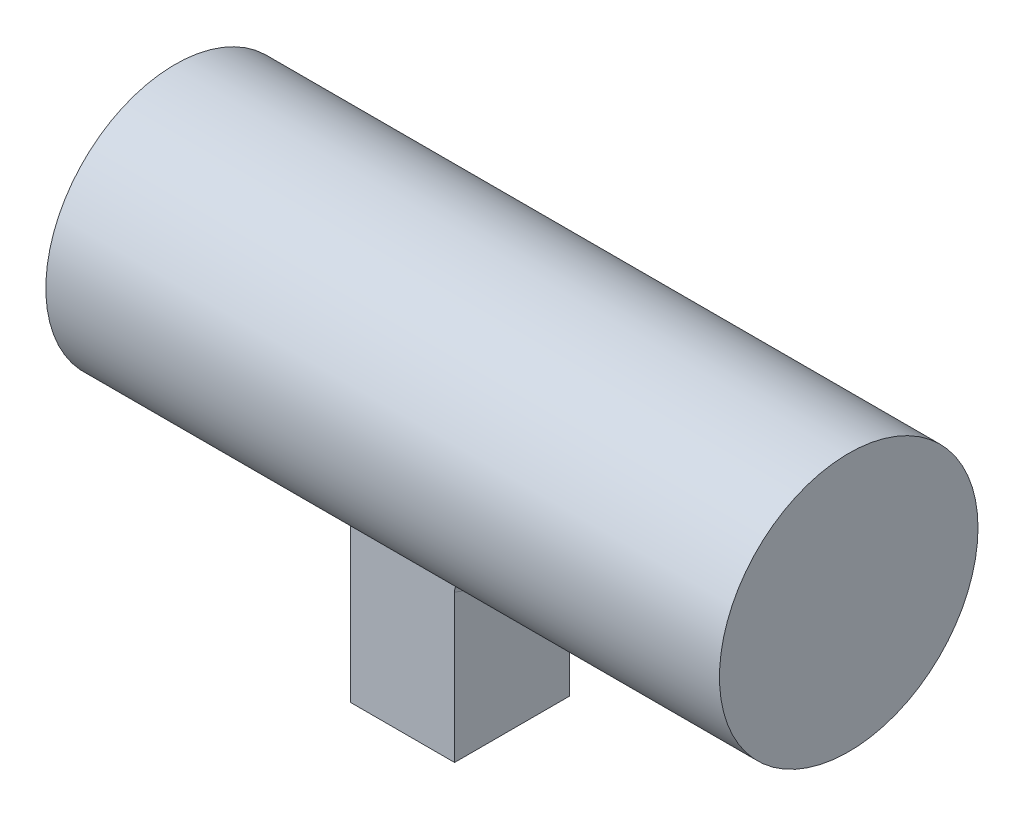
from build123d import *

# Parameters (mm, degrees)
SKETCH_1_W           = 15.445067976
SKETCH_1_H           = 17.0246772
EXTRUDE_1_DEPTH      = 50
EXTRUDE_2_DEPTH      = 50
EXTRUDE_2_DEPTH_BACK = 50
SKETCH_2_R           = 19.191040977
FILLET_3_R           = 2


with BuildPart() as part:
    # 草图1 → 凸台-拉伸1 (new body)
    with BuildSketch(Plane(origin=(0, 0, 0), x_dir=(1, 0, 0), z_dir=(0, 1, 0))):
        Rectangle(SKETCH_1_W, SKETCH_1_H)
    extrude(amount=EXTRUDE_1_DEPTH)

    # 草图2 → 凸台-拉伸2 (add, two sides: drawn at the far end of the back side and taken through both)
    with BuildSketch(Plane(origin=(7.722533988, 0, 0), x_dir=(0, 0, -1), z_dir=(1, 0, 0)).offset(-EXTRUDE_2_DEPTH_BACK)):
        with Locations((0, 41.312136517)):
            Circle(SKETCH_2_R)
    extrude(amount=EXTRUDE_2_DEPTH + EXTRUDE_2_DEPTH_BACK)

    # 圆角3
    # the kernel refuses this fillet: 2 mm, written as the material it adds along each edge
    with BuildSketch(Plane(origin=(7.722533988, 41.312136517, 0), x_dir=(0, -0.7517142761643256, 0.6594889286491047), z_dir=(0, 0.6594889286491047, 0.7517142761643256))) as fillet_3_piece_1_section:
        with BuildLine():
            CenterArc((19.191040977 + FILLET_3_R, FILLET_3_R), FILLET_3_R, 180, 90)
            Line((19.191040977, FILLET_3_R), (19.191040977, 0))
            Line((19.191040977, 0), (19.191040977 + FILLET_3_R, 0))
        make_face()
    fillet_3_piece_1 = revolve(axis=Axis((7.722533988, 41.312136517, 0), (1, 0, 0)), revolution_arc=82.521814453, mode=Mode.PRIVATE)
    fillet_3_piece_1 = split(fillet_3_piece_1, bisect_by=Plane(origin=(8.28980216, 21.553827368, -8.5123386), z_dir=(0, 0, 1)), keep=Keep.TOP, mode=Mode.PRIVATE)
    fillet_3_piece_1 = split(fillet_3_piece_1, bisect_by=Plane(origin=(8.28980216, 21.553827368, 8.5123386), z_dir=(0, 0, -1)), keep=Keep.TOP, mode=Mode.PRIVATE)
    add(fillet_3_piece_1)


solid = part.part
